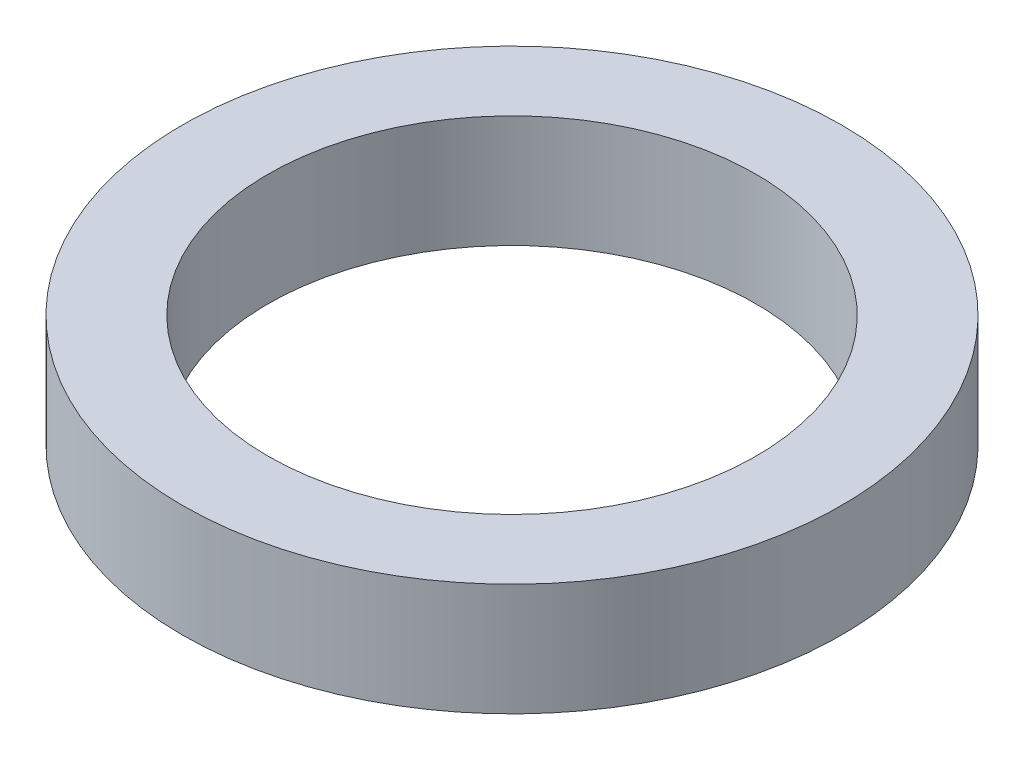
from build123d import *

# Parameters (mm, degrees)
SKETCH1_R           = 67.5
BOSS_EXTRUDE1_DEPTH = 23
SKETCH2_R           = 50
CUT_EXTRUDE1_DEPTH  = 99.19114013


with BuildPart() as part:
    # Sketch1 → Boss-Extrude1 (new body)
    with BuildSketch(Plane(origin=(0, 0, 0), x_dir=(1, 0, 0), z_dir=(0, 1, 0))):
        Circle(SKETCH1_R)
    extrude(amount=BOSS_EXTRUDE1_DEPTH)

    # Sketch2 → Cut-Extrude1 (cut, through all)
    with BuildSketch(Plane(origin=(0, 0, 0), x_dir=(1, 0, 0), z_dir=(0, 1, 0))):
        Circle(SKETCH2_R)
    extrude(amount=CUT_EXTRUDE1_DEPTH, mode=Mode.SUBTRACT)


solid = part.part
